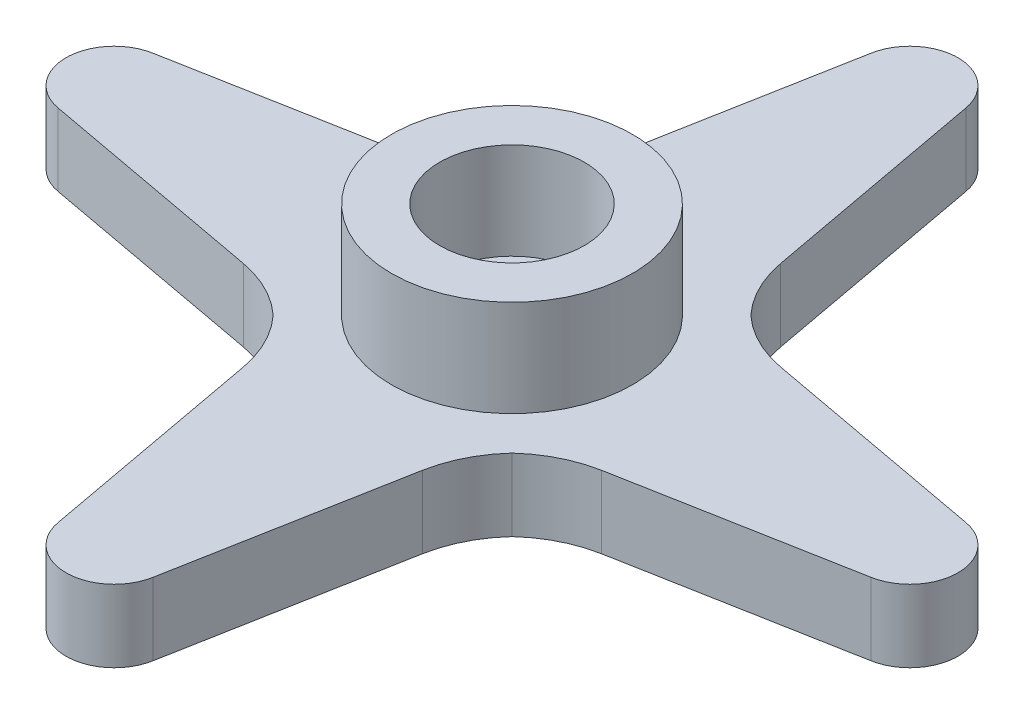
from build123d import *

# Parameters (mm, degrees)
BOSS_EXTRUDE1_DEPTH = 3
SKETCH2_R           = 5
BOSS_EXTRUDE2_DEPTH = 4
SKETCH3_R           = 3
CUT_EXTRUDE1_DEPTH  = 4
FILLET1_R           = 5


with BuildPart() as part:
    # Sketch1 → Boss-Extrude1 (new body)
    with BuildSketch(Plane(origin=(0, 0, 0), x_dir=(1, 0, 0), z_dir=(0, 1, 0))):
        with BuildLine():
            Line((-1.966664332, 16.863636364), (-4.025937287, 5.726415018))
            ThreePointArc((-4.025937287, 5.726415018), (-4.949747468, 4.949747468), (-5.726415018, 4.025937287))
            Line((-5.726415018, 4.025937287), (-16.863636364, 1.966664332))
            ThreePointArc((-16.863636364, 1.966664332), (-18.5, 0), (-16.863636364, -1.966664332))
            Line((-16.863636364, -1.966664332), (-5.726415018, -4.025937287))
            ThreePointArc((-5.726415018, -4.025937287), (-4.949747468, -4.949747468), (-4.025937287, -5.726415018))
            Line((-4.025937287, -5.726415018), (-1.966664332, -16.863636364))
            ThreePointArc((-1.966664332, -16.863636364), (0, -18.5), (1.966664332, -16.863636364))
            Line((1.966664332, -16.863636364), (4.025937287, -5.726415018))
            ThreePointArc((4.025937287, -5.726415018), (4.949747468, -4.949747468), (5.726415018, -4.025937287))
            Line((5.726415018, -4.025937287), (16.863636364, -1.966664332))
            ThreePointArc((16.863636364, -1.966664332), (18.5, 0), (16.863636364, 1.966664332))
            Line((16.863636364, 1.966664332), (5.726415018, 4.025937287))
            ThreePointArc((5.726415018, 4.025937287), (4.949747468, 4.949747468), (4.025937287, 5.726415018))
            Line((4.025937287, 5.726415018), (1.966664332, 16.863636364))
            ThreePointArc((1.966664332, 16.863636364), (0, 18.5), (-1.966664332, 16.863636364))
        make_face()
    extrude(amount=BOSS_EXTRUDE1_DEPTH)

    # Sketch2 → Boss-Extrude2 (add)
    with BuildSketch(Plane(origin=(0, 3, 0), x_dir=(1, 0, 0), z_dir=(0, 1, 0))):
        with Locations(Location((0, 0, 0), (0, 0, 270))):
            Circle(SKETCH2_R)
    extrude(amount=BOSS_EXTRUDE2_DEPTH)

    # Sketch3 → Cut-Extrude1 (cut)
    with BuildSketch(Plane(origin=(0, 7, 0), x_dir=(1, 0, 0), z_dir=(0, 1, 0))):
        with Locations(Location((0, 0, 0), (0, 0, 270))):
            Circle(SKETCH3_R)
    extrude(amount=-CUT_EXTRUDE1_DEPTH, mode=Mode.SUBTRACT)

    # Fillet1
    # the kernel refuses this fillet: 5 mm, written as the material it adds along each edge
    with BuildSketch(Plane(origin=(5.726415018, 0, 4.025937287), x_dir=(0.983332166035634, 0, -0.18181818181817894), z_dir=(0, 1, 0))) as fillet1_piece_1:
        with BuildLine():
            CenterArc((1.734270095, -5), FILLET1_R, 90, 33.557309762)
            ThreePointArc((-1.029583897, -0.833333333), (-0.495036767, -0.441074207), (0, 0))
            Line((0, 0), (1.734270095, 0))
        make_face()
    extrude(amount=3)
    with BuildSketch(Plane(origin=(4.025937287, 0, 5.726415018), x_dir=(0.7599749646341246, 0, -0.6499523468142576), z_dir=(0, 1, 0))) as fillet1_piece_2:
        with BuildLine():
            CenterArc((1.797631616, -4.977571028), FILLET1_R, 95.428999418, 33.557309762)
            Line((-1.348041755, -1.091089451), (0, 0))
            ThreePointArc((0, 0), (0.662285332, -0.031400561), (1.324570664, 0))
        make_face()
    extrude(amount=3)
    with BuildSketch(Plane(origin=(-4.025937287, 0, 5.726415018), x_dir=(-0.7599749646342022, 0, -0.6499523468141668), z_dir=(0, 1, 0)), Plane(origin=(-5.726415018, 0, -4.025937287), x_dir=(0.6499523468141845, 0, -0.7599749646341871), z_dir=(0, 1, 0)), Plane(origin=(4.025937287, 0, -5.726415018), x_dir=(0.7599749646341224, 0, 0.6499523468142602), z_dir=(0, 1, 0))) as fillet1_piece_3:
        with BuildLine():
            CenterArc((1.797631616, 4.977571028), FILLET1_R, 231.01369082, 33.557309762)
            Line((-1.348041755, 1.091089451), (0, 0))
            ThreePointArc((0, 0), (0.662285332, 0.031400561), (1.324570664, 0))
        make_face()
    extrude(amount=3)
    with BuildSketch(Plane(origin=(-5.726415018, 0, 4.025937287), x_dir=(-0.9833321660356334, 0, -0.18181818181818182), z_dir=(0, 1, 0)), Plane(origin=(-4.025937287, 0, -5.726415018), x_dir=(0.1818181818181817, 0, -0.9833321660356334), z_dir=(0, 1, 0)), Plane(origin=(5.726415018, 0, -4.025937287), x_dir=(0.9833321660356329, 0, 0.1818181818181846), z_dir=(0, 1, 0))) as fillet1_piece_4:
        with BuildLine():
            CenterArc((1.734270095, 5), FILLET1_R, 236.442690238, 33.557309762)
            ThreePointArc((-1.029583897, 0.833333333), (-0.495036767, 0.441074207), (0, 0))
            Line((0, 0), (1.734270095, 0))
        make_face()
    extrude(amount=3)


solid = part.part
